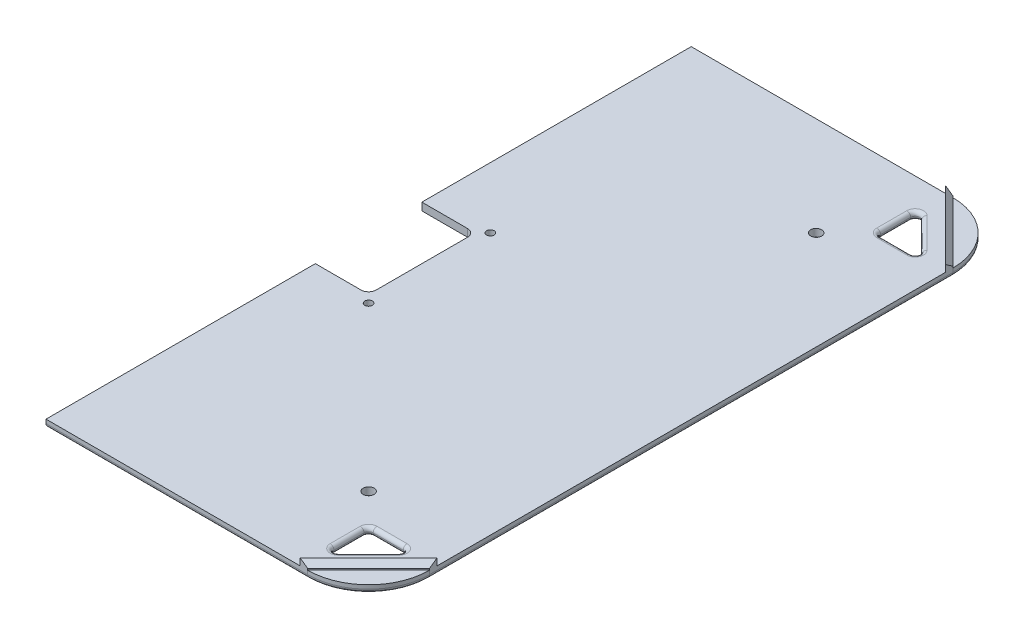
from build123d import *

# Parameters (mm, degrees)
SKETCH1_W           = 134.62
SKETCH1_H           = 269.24
BOSS_EXTRUDE1_DEPTH = 3.175
BOSS_EXTRUDE2_DEPTH = 3.175
CUT_EXTRUDE1_REACH  = 192.408
SKETCH2_3_R         = 2.286
CHAMFER1_SIZE       = 2.54
FILLET1_R           = 1.905
FILLET2_R           = 1.5875
FILLET3_R           = 25.4
FILLET4_R           = 1.5875
SKETCH3_W           = 31.75
SKETCH3_H           = 57.15
BOSS_EXTRUDE3_DEPTH = 3.175
SKETCH4_W           = 50.8
SKETCH4_H           = 3.175
CUT_EXTRUDE2_DEPTH  = 19.05
FILLET5_R           = 12.7
FILLET6_R           = 3.175
CUT_EXTRUDE3_REACH  = 192.478
SKETCH5_W           = 22.225
SKETCH5_H           = 44.45
SKETCH5_R           = 1.5875
FILLET7_R           = 3.175


# Some blends are built 0.0001 mm under size
with BuildPart() as part:
    # Sketch1 → Boss-Extrude1 (new body)
    with BuildSketch(Plane(origin=(0, 0, 0), x_dir=(1, 0, 0), z_dir=(0, 1, 0))):
        with Locations((67.31, 0)):
            Rectangle(SKETCH1_W, SKETCH1_H)
    extrude(amount=BOSS_EXTRUDE1_DEPTH)

    # Sketch2 → Boss-Extrude2 (add)
    with BuildSketch(Plane(origin=(0, 3.175, 0), x_dir=(1, 0, 0), z_dir=(0, 1, 0))):
        Polygon((134.62, 109.22), (109.22, 134.62), (106.045, 134.62), (120.3325, 120.3325), (134.62, 106.045), align=None)
        Polygon((134.62, -109.22), (134.62, -106.045), (120.3325, -120.3325), (106.045, -134.62), (109.22, -134.62), align=None)
    extrude(amount=BOSS_EXTRUDE2_DEPTH)

    # Sketch2<3> → Cut-Extrude1 (cut, up to next)
    with BuildSketch(Plane(origin=(0, 3.175, 0), x_dir=(1, 0, 0), z_dir=(0, 1, 0)), mode=Mode.PRIVATE) as cut_extrude1_sk1:
        with Locations(Location((93.391731637, -93.391731637, 0), (0, 0, 270))):
            Circle(SKETCH2_3_R)
    cut_extrude1_tool1 = extrude(cut_extrude1_sk1.sketch, amount=-CUT_EXTRUDE1_REACH, mode=Mode.PRIVATE) & part.part
    # Sketch2<3> → Cut-Extrude1 (cut, up to next)
    with BuildSketch(Plane(origin=(0, 3.175, 0), x_dir=(1, 0, 0), z_dir=(0, 1, 0)), mode=Mode.PRIVATE) as cut_extrude1_sk2:
        with Locations(Location((93.391731637, 93.391731637, 0), (0, 0, 270))):
            Circle(SKETCH2_3_R)
    cut_extrude1_tool2 = extrude(cut_extrude1_sk2.sketch, amount=-CUT_EXTRUDE1_REACH, mode=Mode.PRIVATE) & part.part
    # Sketch2<3> → Cut-Extrude1 (cut, up to next)
    with BuildSketch(Plane(origin=(0, 3.175, 0), x_dir=(1, 0, 0), z_dir=(0, 1, 0)), mode=Mode.PRIVATE) as cut_extrude1_sk3:
        Polygon((105.868359133, -124.918359133), (124.918359133, -105.868359133), (105.868359133, -105.868359133), align=None)
    cut_extrude1_tool3 = extrude(cut_extrude1_sk3.sketch, amount=-CUT_EXTRUDE1_REACH, mode=Mode.PRIVATE) & part.part
    # Sketch2<3> → Cut-Extrude1 (cut, up to next)
    with BuildSketch(Plane(origin=(0, 3.175, 0), x_dir=(1, 0, 0), z_dir=(0, 1, 0)), mode=Mode.PRIVATE) as cut_extrude1_sk4:
        Polygon((124.918359133, 105.868359133), (105.868359133, 124.918359133), (105.868359133, 105.868359133), align=None)
    cut_extrude1_tool4 = extrude(cut_extrude1_sk4.sketch, amount=-CUT_EXTRUDE1_REACH, mode=Mode.PRIVATE) & part.part
    add(cut_extrude1_tool1.solids().sort_by_distance((93.391732, 3.175, 93.391732))[0], mode=Mode.SUBTRACT)
    add(cut_extrude1_tool2.solids().sort_by_distance((93.391732, 3.175, -93.391732))[0], mode=Mode.SUBTRACT)
    add(cut_extrude1_tool3.solids().sort_by_distance((112.218359, 3.175, 112.218359))[0], mode=Mode.SUBTRACT)
    add(cut_extrude1_tool4.solids().sort_by_distance((112.218359, 3.175, -112.218359))[0], mode=Mode.SUBTRACT)

    # Chamfer1
    # the kernel refuses this chamfer: 2.54 mm, written as the material it takes off along each edge
    with BuildSketch(Plane(origin=(104.601125621, 6.35, 139.238874379), x_dir=(0.019442520806015235, -0.9996219169112966, 0.019442520806015006), z_dir=(0.7071067811865434, 0, -0.7071067811865517)), Plane(origin=(139.238874379, 6.35, -104.601125621), x_dir=(0.019442520806015124, -0.9996219169112966, -0.019442520806015124), z_dir=(-0.7071067811865476, 0, -0.7071067811865476))) as chamfer1_piece_1:
        Polygon((CHAMFER1_SIZE * 0.999621916911, CHAMFER1_SIZE * 0.0274958766106), (-CHAMFER1_SIZE * 0.0274958766106, CHAMFER1_SIZE * 0.999621916911), (0, 0), align=None)
    extrude(amount=48.985174063, mode=Mode.SUBTRACT)

    # Fillet1
    fillet1_edges = [part.edges().sort_by_distance(p)[0] for p in [
        (105.868359133, 1.5875, -124.918359133),
        (124.918359133, 1.5875, -105.868359133),
        (105.868359133, 1.5875, -105.868359133),
        (105.868359133, 1.5875, 105.868359133),
        (124.918359133, 1.5875, 105.868359133),
        (105.868359133, 1.5875, 124.918359133),
    ]]
    fillet(fillet1_edges, radius=FILLET1_R)

    # Fillet2
    fillet2_edges = [part.edges().sort_by_distance(p)[0] for p in [
        (107.044347195, 3.175, 122.079272807),
        (105.868359133, 3.175, 114.046320715),
        (106.426320715, 3.175, 106.426320715),
        (114.046320715, 3.175, 105.868359133),
        (122.079272807, 3.175, 107.044347195),
        (122.079272807, 0, 107.044347195),
        (114.046320715, 0, 105.868359133),
        (106.426320715, 0, 106.426320715),
        (105.868359133, 0, 114.046320715),
        (107.044347195, 0, 122.079272807),
        (122.079272807, 3.175, -107.044347195),
        (114.046320715, 3.175, -105.868359133),
        (106.426320715, 3.175, -106.426320715),
        (105.868359133, 3.175, -114.046320715),
        (107.044347195, 3.175, -122.079272807),
        (107.044347195, 0, -122.079272807),
        (105.868359133, 0, -114.046320715),
        (106.426320715, 0, -106.426320715),
        (114.046320715, 0, -105.868359133),
        (122.079272807, 0, -107.044347195),
        (115.393359133, 3.175, 115.393359133),
        (115.393359133, 0, 115.393359133),
        (115.393359133, 3.175, -115.393359133),
        (115.393359133, 0, -115.393359133),
    ]]
    fillet(fillet2_edges, radius=FILLET2_R - 0.0001)  # a hair under: the kernel refuses the full size

    # Fillet3
    fillet3_edges = [part.edges().sort_by_distance(p)[0] for p in [
        (134.62, 1.5875, -134.62),
        (134.62, 1.5875, 134.62),
    ]]
    fillet(fillet3_edges, radius=FILLET3_R)

    # Fillet4
    fillet4_edges = [part.edges().sort_by_distance(p)[0] for p in [
        (134.62, 0, 0),
        (127.180512242, 0, 127.180512242),
        (127.180512242, 0, -127.180512242),
        (54.61, 0, -134.62),
        (54.61, 0, 134.62),
    ]]
    fillet(fillet4_edges, radius=FILLET4_R)

    # Sketch3 → Boss-Extrude3 (add)
    with BuildSketch(Plane.XZ):
        with Locations((15.875, 82.2325)):
            Rectangle(SKETCH3_W, SKETCH3_H)
        with Locations((15.875, -82.2325)):
            Rectangle(SKETCH3_W, SKETCH3_H)
    extrude(amount=BOSS_EXTRUDE3_DEPTH)

    # Sketch4 → Cut-Extrude2 (cut)
    with BuildSketch(Plane.ZY):
        with Locations((82.2325, 0)):
            Rectangle(SKETCH4_W, SKETCH4_H)
        with Locations((-82.2325, 0)):
            Rectangle(SKETCH4_W, SKETCH4_H)
    extrude(amount=-CUT_EXTRUDE2_DEPTH, mode=Mode.SUBTRACT)

    # Fillet5
    fillet5_edges = [part.edges().sort_by_distance(p)[0] for p in [
        (31.75, -1.5875, 53.6575),
        (31.75, -1.5875, 110.8075),
        (31.75, -1.5875, -110.8075),
        (31.75, -1.5875, -53.6575),
    ]]
    fillet(fillet5_edges, radius=FILLET5_R)

    # Fillet6
    fillet6_edges = [part.edges().sort_by_distance(p)[0] for p in [
        (9.525, -3.175, -110.8075),
        (28.030256121, -3.175, -107.087756121),
        (31.75, -3.175, -82.2325),
        (28.030256121, -3.175, -57.377243879),
        (9.525, -3.175, 53.6575),
        (28.030256121, -3.175, 57.377243879),
        (31.75, -3.175, 82.2325),
        (28.030256121, -3.175, 107.087756121),
        (9.525, -3.175, -53.6575),
        (9.525, -3.175, 110.8075),
    ]]
    fillet(fillet6_edges, radius=FILLET6_R - 0.0001)  # a hair under: the kernel refuses the full size

    # Sketch5 → Cut-Extrude3 (cut, up to next)
    with BuildSketch(Plane.XZ, mode=Mode.PRIVATE) as cut_extrude3_sk1:
        with Locations((11.1125, 0)):
            Rectangle(SKETCH5_W, SKETCH5_H)
    cut_extrude3_tool1 = extrude(cut_extrude3_sk1.sketch, amount=-CUT_EXTRUDE3_REACH, mode=Mode.PRIVATE) & part.part
    # Sketch5 → Cut-Extrude3 (cut, up to next)
    with BuildSketch(Plane.XZ, mode=Mode.PRIVATE) as cut_extrude3_sk2:
        with Locations(Location((25.4, 25.4, 0), (0, 0, 270))):
            Circle(SKETCH5_R)
    cut_extrude3_tool2 = extrude(cut_extrude3_sk2.sketch, amount=-CUT_EXTRUDE3_REACH, mode=Mode.PRIVATE) & part.part
    # Sketch5 → Cut-Extrude3 (cut, up to next)
    with BuildSketch(Plane.XZ, mode=Mode.PRIVATE) as cut_extrude3_sk3:
        with Locations(Location((25.4, -25.4, 0), (0, 0, 270))):
            Circle(SKETCH5_R)
    cut_extrude3_tool3 = extrude(cut_extrude3_sk3.sketch, amount=-CUT_EXTRUDE3_REACH, mode=Mode.PRIVATE) & part.part
    add(cut_extrude3_tool1.solids().sort_by_distance((11.1125, 0, 0))[0], mode=Mode.SUBTRACT)
    add(cut_extrude3_tool2.solids().sort_by_distance((25.4, 0, 25.4))[0], mode=Mode.SUBTRACT)
    add(cut_extrude3_tool3.solids().sort_by_distance((25.4, 0, -25.4))[0], mode=Mode.SUBTRACT)

    # Fillet7
    fillet7_edges = [part.edges().sort_by_distance(p)[0] for p in [
        (22.225, 1.5875, 22.225),
        (22.225, 1.5875, -22.225),
    ]]
    fillet(fillet7_edges, radius=FILLET7_R)


solid = part.part
